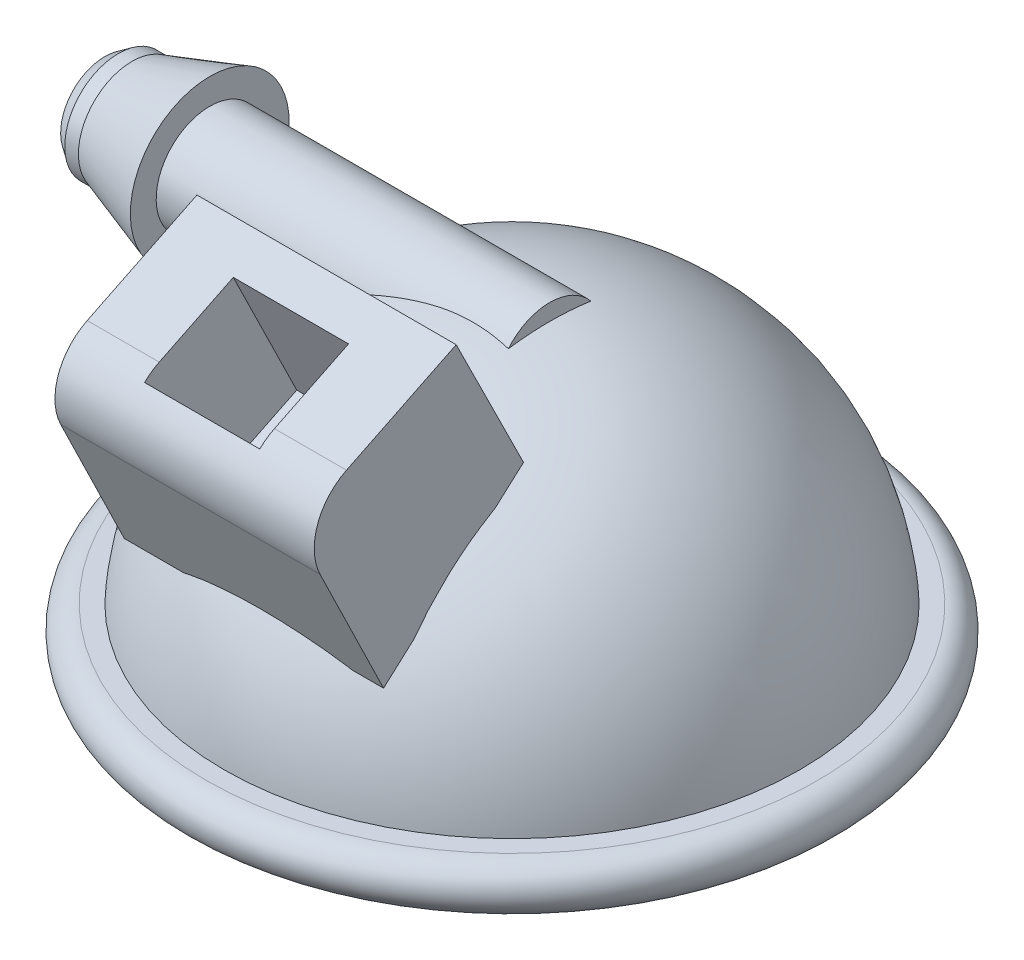
from build123d import *

# Parameters (mm, degrees)
SKETCH6_R           = 0.6
CUT_EXTRUDE2_DEPTH  = 6
SKETCH7_R           = 0.930249934
SKETCH7_R_2         = 0.6
BOSS_EXTRUDE2_DEPTH = 4
BOSS_EXTRUDE3_DEPTH = 4.5
SKETCH10_W          = 2
SKETCH10_H          = 1.74
CUT_EXTRUDE3_DEPTH  = 2.5
FILLET2_R           = 1


with BuildPart() as part:
    # Sketch1 → Revolve1 (revolve)
    with BuildSketch(Plane.XY, mode=Mode.PRIVATE) as revolve1_sk:
        with BuildLine():
            Line((2.497694231, 4.636242165), (2.497694231, 5.015768717))
            ThreePointArc((2.497694231, 5.015768717), (-0.904769349, 3.691451593), (-2.499813377, 0.407184734))
            Line((-2.499813377, 0.407184734), (-2.815131358, 0.408216514))
            ThreePointArc((-2.815131358, 0.408216514), (-3.223347872, 0), (-2.815131358, -0.408216514))
            Line((-2.815131358, -0.408216514), (-2.515131358, -0.408216514))
            ThreePointArc((-2.515131358, -0.408216514), (-2.23135067, -0.285318602), (-2.115133351, 0.001262818))
            ThreePointArc((-2.115133351, 0.001262818), (-0.747635465, 3.253181075), (2.497694231, 4.636242165))
        make_face()
    revolve(revolve1_sk.sketch.rotate(Axis((2.497694231, 0, 0), (0, 1, 0)), 270), axis=Axis((2.497694231, 0, 0), (0, 1, 0)))

    # Sketch5 → Revolve2 (revolve)
    with BuildSketch(Plane.XY, mode=Mode.PRIVATE) as revolve2_sk:
        Polygon((-0.848304492, 3.399770651), (-0.848304492, 3.730020585), (-4.571479076, 3.730020585), (-4.571479076, 3.564895618), (-4.334897594, 3.399770651), (-4.098316112, 3.399770651), (-2.748304492, 2.951405673), (-2.748304492, 3.399770651), align=None)
    revolve(revolve2_sk.sketch.rotate(Axis((-2.145497503, 4.330020585, 0), (-1, 0, 0)), 180), axis=Axis((-2.145497503, 4.330020585, 0), (-1, 0, 0)))

    # Sketch6 → Cut-Extrude2 (cut)
    with BuildSketch(Plane.ZY.offset(3.971479076)):
        with Locations(Location((0, 4.330020585, 0), (0, 0, 90))):
            Circle(SKETCH6_R)
    extrude(amount=-CUT_EXTRUDE2_DEPTH, mode=Mode.SUBTRACT)

    # Sketch7 → Boss-Extrude2 (add)
    with BuildSketch(Plane(origin=(-0.848304492, 0, 0), x_dir=(0, 0, -1), z_dir=(1, 0, 0))):
        with Locations(Location((0, 4.330020585, 0), (0, 0, 90))):
            Circle(SKETCH7_R)
        with Locations(Location((0, 4.330020585, 0), (0, 0, 90))):
            Circle(SKETCH7_R_2, mode=Mode.SUBTRACT)
    extrude(amount=BOSS_EXTRUDE2_DEPTH)


with BuildPart() as body_2:
    # Sketch9 → Boss-Extrude3 (new body)
    with BuildSketch(Plane(origin=(0, 0, 0), x_dir=(0, 0, -1), z_dir=(1, 0, 0))):
        Polygon((-4.457113398, 2.715289709), (-5.771124288, 5.412209318), (-2.970817151, 6.785677296), (-1.802401547, 4.431947558), (-4.23167441, 2.25259124), align=None)
    extrude(amount=BOSS_EXTRUDE3_DEPTH)


with BuildPart() as cut_extrude3_tool:
    # Sketch10 → Cut-Extrude3 (new body)
    with BuildSketch(Plane(origin=(0, 6.644391917, 3.258878075), x_dir=(1, 0, 0), z_dir=(0, 0.8978233321334088, 0.4403558382454614))):
        with Locations((2.25, -1.238654204)):
            Rectangle(SKETCH10_W, SKETCH10_H)
    extrude(amount=-CUT_EXTRUDE3_DEPTH)


with BuildPart() as part_1:
    add(part.part)

    # Cut-Extrude3: cut by cut_extrude3_tool
    add(cut_extrude3_tool.part, mode=Mode.SUBTRACT)


with BuildPart() as body_2_1:
    add(body_2.part)

    # Cut-Extrude3: cut by cut_extrude3_tool
    add(cut_extrude3_tool.part, mode=Mode.SUBTRACT)

    # Fillet2
    # the kernel refuses this fillet: 1 mm, written as the material it takes off along each edge
    with BuildSketch(Plane(origin=(-2.493462997, 5.412209318, 5.771124288), x_dir=(0, -0.8989732031927672, -0.43800363005497533), z_dir=(1, 0, 0))) as fillet2_piece_1:
        with BuildLine():
            CenterArc((FILLET2_R * 0.997385198751, FILLET2_R), FILLET2_R, 180.150013117, 89.849986883)
            Line((-FILLET2_R * 0.00261137370519, FILLET2_R * 0.99738178017), (0, 0))
            Line((0, 0), (FILLET2_R * 0.997385198751, 0))
        make_face()
    extrude(amount=9.486925994, mode=Mode.SUBTRACT)


with BuildPart() as cut_revolve1_tool:
    # Sketch8 → Cut-Revolve1 (revolve)
    with BuildSketch(Plane.XY):
        with BuildLine():
            Line((7.110521813, 0.001262818), (2.497694231, 0.001262818))
            Line((2.497694231, 0.001262818), (2.497694231, 4.595570156))
            ThreePointArc((2.497694231, 4.595570156), (5.764363493, 3.262542872), (7.110521813, 0.001262818))
        make_face()
    revolve(axis=Axis((2.497694231, 0.001262818, 0), (0, 1, 0)))


with BuildPart() as part_2:
    add(part_1.part)

    # Cut-Revolve1: cut by cut_revolve1_tool
    add(cut_revolve1_tool.part, mode=Mode.SUBTRACT)


with BuildPart() as body_2_2:
    add(body_2_1.part)

    # Cut-Revolve1: cut by cut_revolve1_tool
    add(cut_revolve1_tool.part, mode=Mode.SUBTRACT)


solid = Compound([part_2.part, body_2_2.part])
